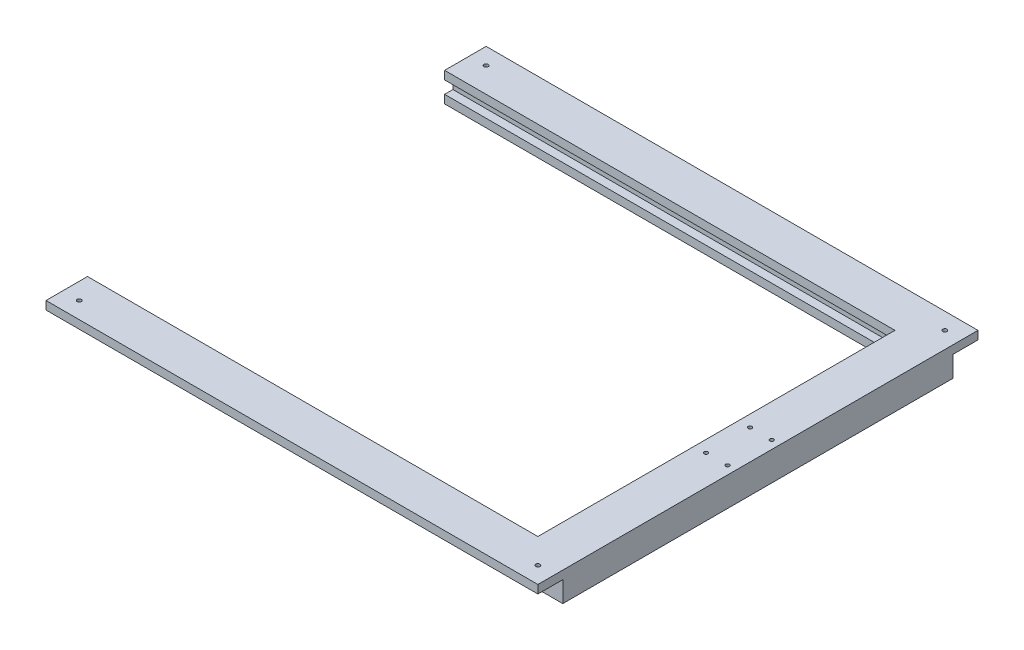
from build123d import *

# Parameters (mm, degrees)
EXTRUDE_2_DEPTH             = 10
EXTRUDE_3_DEPTH             = 15
SKETCH_4_R                  = 2.5
CUT_EXTRUDE_1_DEPTH         = 816.035490032
PATTERN_LINEAR_2_COUNT      = 2
PATTERN_LINEAR_2_PITCH      = 552.3
PATTERN_LINEAR_2_COUNT_DIR2 = 2
PATTERN_LINEAR_2_PITCH_DIR2 = 490
EXTRUDE_4_DEPTH             = 10
SKETCH_6_R                  = 2.25
CUT_EXTRUDE_2_DEPTH         = 816.403489085


with BuildPart() as part:
    # Эскиз1 → Бобышка-Вытянуть2 (new body)
    with BuildSketch(Plane(origin=(0, 0, 0), x_dir=(1, 0, 0), z_dir=(0, 1, 0))):
        Polygon((50, -77.921508101), (50, -607.921508101), (-542.3, -607.921508101), (-542.3, -557.921508101), (0, -557.921508101), (0, -127.921508101), (-542.3, -127.921508101), (-542.3, -77.921508101), align=None)
    extrude(amount=EXTRUDE_2_DEPTH)

    # Эскиз2 → Бобышка-Вытянуть3 (add)
    with BuildSketch(Plane.XZ):
        Polygon((50, 577.921508101), (50, 107.921508101), (-542.3, 107.921508101), (-542.3, 117.921508101), (10, 117.921508101), (10, 567.921508101), (-542.3, 567.921508101), (-542.3, 577.921508101), align=None)
    extrude(amount=EXTRUDE_3_DEPTH)

    # Эскиз4 → Вырез-Вытянуть1 (cut, through all)
    with BuildSketch(Plane(origin=(0, 10, 0), x_dir=(1, 0, 0), z_dir=(0, 1, 0))):
        with Locations((-522.3, -97.921508101)):
            Circle(SKETCH_4_R)
    cut_extrude_1 = extrude(amount=-CUT_EXTRUDE_1_DEPTH, mode=Mode.SUBTRACT)

    # Линейный массив2: Cut-Extrude 1 2 × 2
    with Locations(*[(i * PATTERN_LINEAR_2_PITCH, 0, j * PATTERN_LINEAR_2_PITCH_DIR2) for i in range(PATTERN_LINEAR_2_COUNT) for j in range(PATTERN_LINEAR_2_COUNT_DIR2) if (i, j) != (0, 0)]):
        add(cut_extrude_1, mode=Mode.SUBTRACT)

    # Эскиз5 → Бобышка-Вытянуть4 (add)
    with BuildSketch(Plane.XZ.offset(15)):
        Polygon((50, 577.921508101), (-542.3, 577.921508101), (-542.3, 557.921508101), (0, 557.921508101), (0, 127.921508101), (-542.3, 127.921508101), (-542.3, 107.921508101), (50, 107.921508101), align=None)
    extrude(amount=EXTRUDE_4_DEPTH)

    # Эскиз6 → Вырез-Вытянуть2 (cut, through all)
    with BuildSketch(Plane.XZ.offset(25)):
        with Locations((14, 369.421508101)):
            Circle(SKETCH_6_R)
        with Locations((40, 369.421508101)):
            Circle(SKETCH_6_R)
        with Locations((40, 316.421508101)):
            Circle(SKETCH_6_R)
        with Locations((14, 316.421508101)):
            Circle(SKETCH_6_R)
    extrude(amount=-CUT_EXTRUDE_2_DEPTH, mode=Mode.SUBTRACT)


solid = part.part
